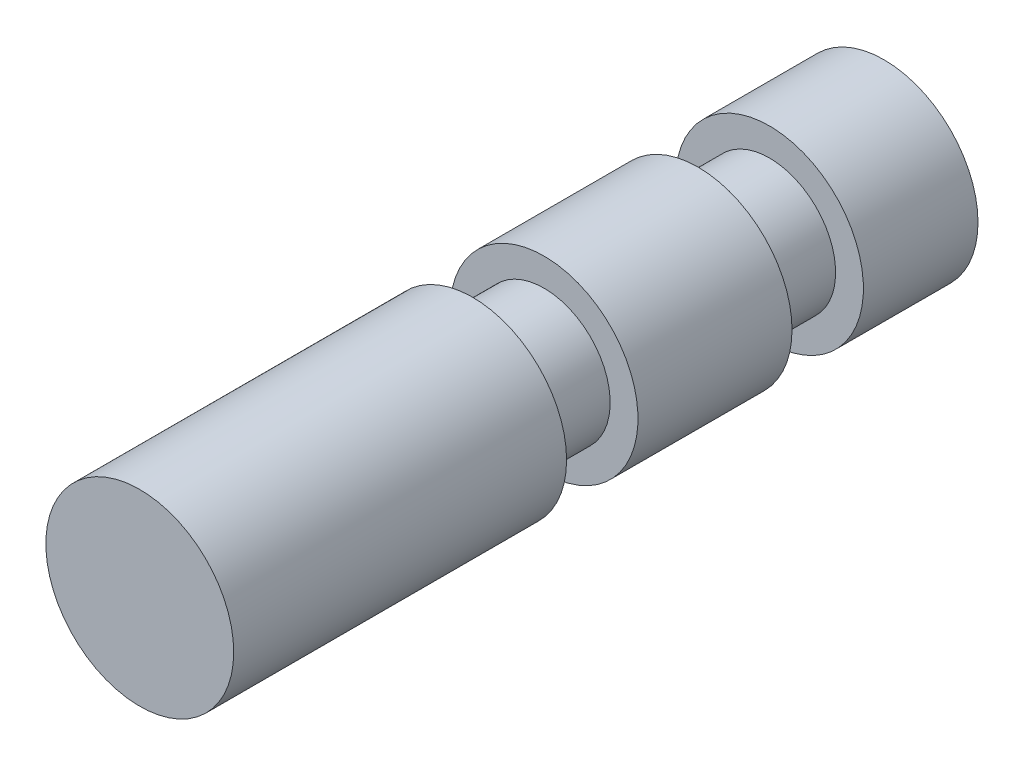
from build123d import *

# Parameters (mm, degrees)
SKETCH1_R           = 3.175
BOSS_EXTRUDE1_DEPTH = 25.1587
SKETCH9_R           = 1.397
CUT_EXTRUDE3_DEPTH  = 7.62
SKETCH4_W           = 2.413
SKETCH4_H           = 1.4224
LPATTERN1_COUNT     = 2
LPATTERN1_PITCH     = 7.62


with BuildPart() as part:
    # Sketch1 → Boss-Extrude1 (new body)
    with BuildSketch(Plane.XY):
        Circle(SKETCH1_R)
    extrude(amount=BOSS_EXTRUDE1_DEPTH)

    # Sketch9 → Cut-Extrude3 (cut)
    with BuildSketch(Plane(origin=(0, 0, 0), x_dir=(-1, 0, 0), z_dir=(0, 0, -1))):
        Circle(SKETCH9_R)
    extrude(amount=-CUT_EXTRUDE3_DEPTH, mode=Mode.SUBTRACT)

    # Sketch4 → Cut-Revolve1 (revolve, cut)
    with BuildSketch(Plane(origin=(0, 0, 0), x_dir=(0, 0, -1), z_dir=(1, 0, 0))):
        with Locations((-5.08, 2.9464)):
            Rectangle(SKETCH4_W, SKETCH4_H)
    cut_revolve1 = revolve(axis=Axis((0, 0, 0), (0, 0, 1)), mode=Mode.SUBTRACT)

    # LPattern1: Cut-Revolve1 ×2
    with Locations(*[(0, 0, i * LPATTERN1_PITCH) for i in range(1, LPATTERN1_COUNT)]):
        add(cut_revolve1, mode=Mode.SUBTRACT)


solid = part.part
